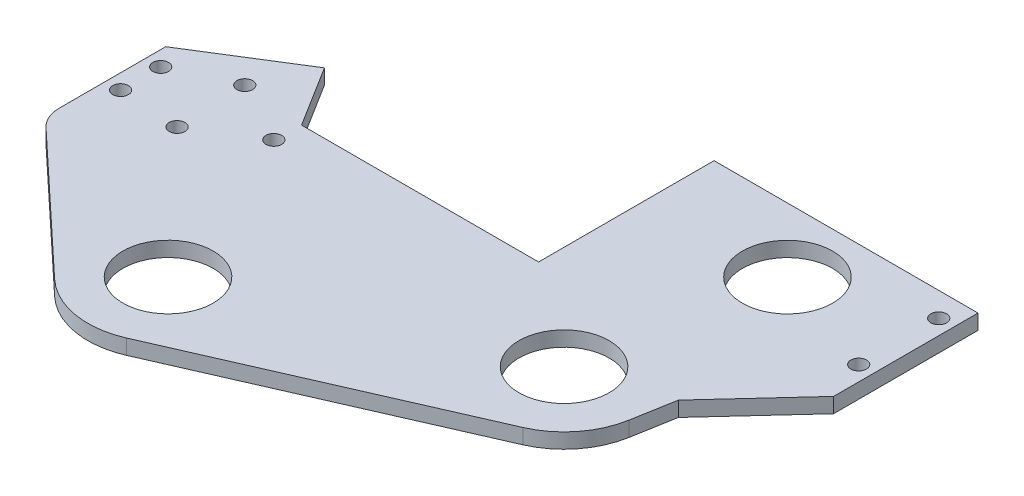
from build123d import *

# Parameters (mm, degrees)
SKETCH1_R              = 14.29004
BOSS_EXTRUDE1_DEPTH    = 4.7625
FILLET1_R              = 10
F_10_CLEARANCE_HOLE1_D = 4.9784
F_10_CLEARANCE_HOLE2_D = 4.9784


with BuildPart() as part:
    # Sketch1 → Boss-Extrude1 (new body)
    with BuildSketch(Plane(origin=(0, 0, 0), x_dir=(1, 0, 0), z_dir=(0, 1, 0))):
        with BuildLine():
            Line((-62.06952, -79.895280222), (25.163028109, -41.695780276))
            ThreePointArc((25.163028109, -41.695780276), (34.911191298, -34.148496119), (39.936134607, -22.890693115))
            Line((39.936134607, -22.890693115), (42.271095404, -9.586739751))
            Line((42.271095404, -9.586739751), (65.82695514, 16.012754812))
            Line((65.82695514, 16.012754812), (65.826833771, 61.726825209))
            Line((65.826833771, 61.726825209), (-17.734439664, 61.726825209))
            Line((-17.734439664, 61.726825209), (-17.734439664, 6.164245545))
            Line((-17.734439664, 6.164245545), (-92.776319002, 6.164245545))
            Line((-92.776319002, 6.164245545), (-104.854054452, 25.49254843))
            Line((-104.854054452, 25.49254843), (-135.785609254, 6.16425364))
            Line((-135.785609254, 6.16425364), (-135.785609254, -31.935712293))
            Line((-135.785609254, -31.935712293), (-89.620113812, -75.16814328))
            ThreePointArc((-89.620113812, -75.16814328), (-76.553580444, -81.662511553), (-62.06952, -79.895280222))
        make_face()
        with Locations((25.821833771, 41.412625209)):
            Circle(SKETCH1_R, mode=Mode.SUBTRACT)
        with Locations((15.012562201, -18.516537909)):
            Circle(SKETCH1_R, mode=Mode.SUBTRACT)
        with Locations((-72.258332946, -56.628468385)):
            Circle(SKETCH1_R, mode=Mode.SUBTRACT)
    extrude(amount=BOSS_EXTRUDE1_DEPTH)

    # Fillet1
    fillet1_edges = [part.edges().sort_by_distance(p)[0] for p in [
        (-135.785609254, 2.38125, 31.935712293),
    ]]
    fillet(fillet1_edges, radius=FILLET1_R)

    # #10 Clearance Hole1 (through all)
    with Locations(Plane(origin=(0, 4.7625, 0), x_dir=(1, 0, 0), z_dir=(0, 1, 0))):
        with Locations((61.064354133, 54.057452946), (61.064421422, 28.712718776), (-131.023109254, -0.185754455), (-131.023109254, -12.885754455)):
            Hole(F_10_CLEARANCE_HOLE1_D / 2)

    # #10 Clearance Hole2 (through all)
    with Locations(Plane(origin=(0, 4.7625, 0), x_dir=(1, 0, 0), z_dir=(0, 1, 0))):
        with Locations((-111.967266406, -14.051352939), (-93.119428737, -2.273847251), (-112.732572492, 8.143472036)):
            Hole(F_10_CLEARANCE_HOLE2_D / 2)


solid = part.part
